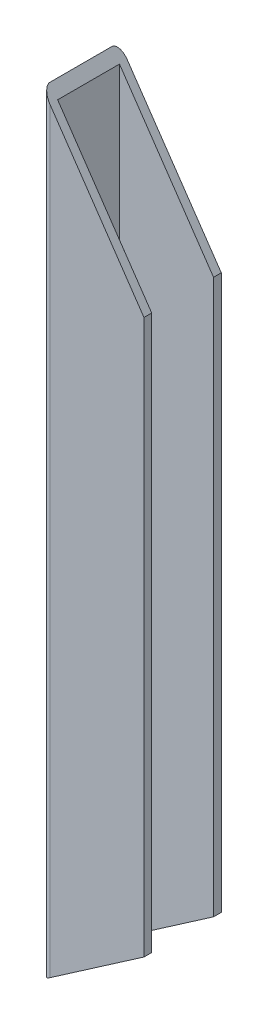
from build123d import *

# Parameters (mm, degrees)
SKETCH_1_W          = 74
SKETCH_1_H          = 24
EXTRUDE_1_DEPTH     = 300
SKETCH_2_W          = 41.646480438
SKETCH_2_H          = 42.526894273
CUT_EXTRUDE_1_DEPTH = 304.02640149
SKETCH_3_OUTSIDE_W  = 102.314
SKETCH_3_OUTSIDE_H  = 362.814
CUT_EXTRUDE_2_DEPTH = 305.138126515


with BuildPart() as part:
    # Эскиз1 → Вытянуть-Тонкостенный1 (new body)
    with BuildSketch(Plane(origin=(0, 0, 0), x_dir=(1, 0, 0), z_dir=(0, 1, 0))):
        with BuildLine():
            Line((40, 12), (40, -12))
            ThreePointArc((40, -12), (39.121320344, -14.121320344), (37, -15))
            Line((37, -15), (-37, -15))
            ThreePointArc((-37, -15), (-39.121320344, -14.121320344), (-40, -12))
            Line((-40, -12), (-40, 12))
            ThreePointArc((-40, 12), (-39.121320344, 14.121320344), (-37, 15))
            Line((-37, 15), (37, 15))
            ThreePointArc((37, 15), (39.121320344, 14.121320344), (40, 12))
        make_face()
        Rectangle(SKETCH_1_W, SKETCH_1_H, mode=Mode.SUBTRACT)
    extrude(amount=EXTRUDE_1_DEPTH)

    # Эскиз2 → Вырез-Вытянуть1 (cut, through all)
    with BuildSketch(Plane(origin=(0, 300, 0), x_dir=(1, 0, 0), z_dir=(0, 1, 0))):
        with Locations((20.323240219, -0.290673418)):
            Rectangle(SKETCH_2_W, SKETCH_2_H)
    extrude(amount=-CUT_EXTRUDE_1_DEPTH, mode=Mode.SUBTRACT)

    # Эскиз3 outside → Вырез-Вытянуть2 (cut, through all)
    with BuildSketch(Plane.XY.offset(15)):
        with Locations((-20.25, 150)):
            Rectangle(SKETCH_3_OUTSIDE_W, SKETCH_3_OUTSIDE_H)
        Polygon((-40, 300), (-0.5, 242.209429835), (-0.5, 27.271780287), (-40, 0), align=None, mode=Mode.SUBTRACT)
    extrude(amount=-CUT_EXTRUDE_2_DEPTH, mode=Mode.SUBTRACT)


solid = part.part
